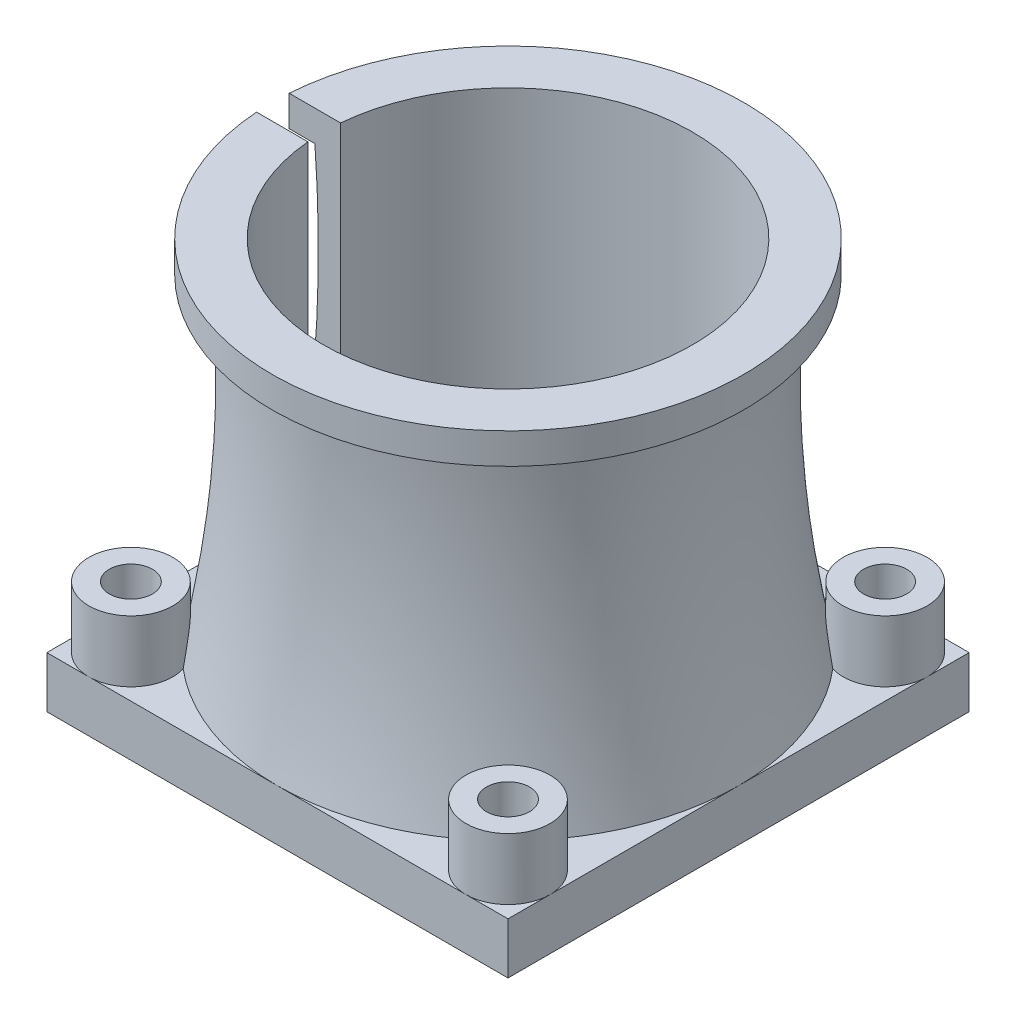
from build123d import *

# Parameters (mm, degrees)
SKETCH1_W            = 45
SKETCH1_H            = 45
SKETCH1_R            = 17
BOSS_EXTRUDE1_DEPTH  = 5
CUT_EXTRUDE1_DEPTH   = 52.555795019
SKETCH4_R            = 2.1
CUT_EXTRUDE3_DEPTH   = 52.555795096
BOSS_EXTRUDE3_START  = 11
SKETCH5_R            = 4.1
SKETCH5_R_2          = 2.1
BOSS_EXTRUDE3_DEPTH  = 11
LPATTERN1_COUNT      = 2
LPATTERN1_PITCH      = 36.8
LPATTERN1_COUNT_DIR2 = 2
LPATTERN1_PITCH_DIR2 = 36.8


with BuildPart() as part:
    # Sketch2 → Revolve1 (revolve)
    with BuildSketch(Plane.XY):
        with BuildLine():
            Line((-18, 40), (-18, 0))
            Line((-18, 0), (-22.5, 0))
            Line((-22.5, 0), (-22.5, 5))
            add(Edge.make_bspline(
                [(-20.5, 37), (-19.278657386, 20.724041917), (-22.5, 5)],
                knots=[0, 0, 0, 0.828873542, 0.828873542, 0.828873542], degree=2))
            Line((-20.5, 37), (-23, 37))
            Line((-23, 37), (-23, 40))
            Line((-23, 40), (-18, 40))
        make_face()
    revolve(axis=Axis((0, 0, 0), (0, 1, 0)))

    # Sketch1 → Boss-Extrude1 (add)
    with BuildSketch(Plane(origin=(0, 0, 0), x_dir=(1, 0, 0), z_dir=(0, 1, 0))):
        Rectangle(SKETCH1_W, SKETCH1_H)
        Circle(SKETCH1_R, mode=Mode.SUBTRACT)
    extrude(amount=BOSS_EXTRUDE1_DEPTH)

    # Sketch3 → Cut-Extrude1 (cut, through all)
    with BuildSketch(Plane(origin=(0, 0, 0), x_dir=(0, 0, -1), z_dir=(1, 0, 0))):
        Polygon((1.592767502, 61.452229193), (-1.592767502, 61.452229193), (-1.592767502, 18.547770807), (0, 15.635287857), (1.592767502, 18.547770807), align=None)
    extrude(amount=-CUT_EXTRUDE1_DEPTH, mode=Mode.SUBTRACT)

    # Sketch4 → Cut-Extrude3 (cut, symmetric)
    with BuildSketch(Plane(origin=(0, 0, 0), x_dir=(1, 0, 0), z_dir=(0, 1, 0))):
        with Locations((-18.4, -18.4)):
            Circle(SKETCH4_R)
    cut_extrude3 = extrude(amount=CUT_EXTRUDE3_DEPTH, both=True, mode=Mode.SUBTRACT)

    # Sketch5 → Boss-Extrude3 (add)
    with BuildSketch(Plane(origin=(0, 0, 0), x_dir=(1, 0, 0), z_dir=(0, 1, 0)).offset(BOSS_EXTRUDE3_START)):
        with Locations((-18.4, -18.4)):
            Circle(SKETCH5_R)
        with Locations((-18.4, -18.4)):
            Circle(SKETCH5_R_2, mode=Mode.SUBTRACT)
    boss_extrude3 = extrude(amount=-BOSS_EXTRUDE3_DEPTH)

    # LPattern1: Cut-Extrude3, Boss-Extrude3 2 × 2
    with Locations(*[(j * LPATTERN1_PITCH_DIR2, 0, -i * LPATTERN1_PITCH) for i in range(LPATTERN1_COUNT) for j in range(LPATTERN1_COUNT_DIR2) if (i, j) != (0, 0)]):
        add(cut_extrude3, mode=Mode.SUBTRACT)
        add(boss_extrude3)


solid = part.part
